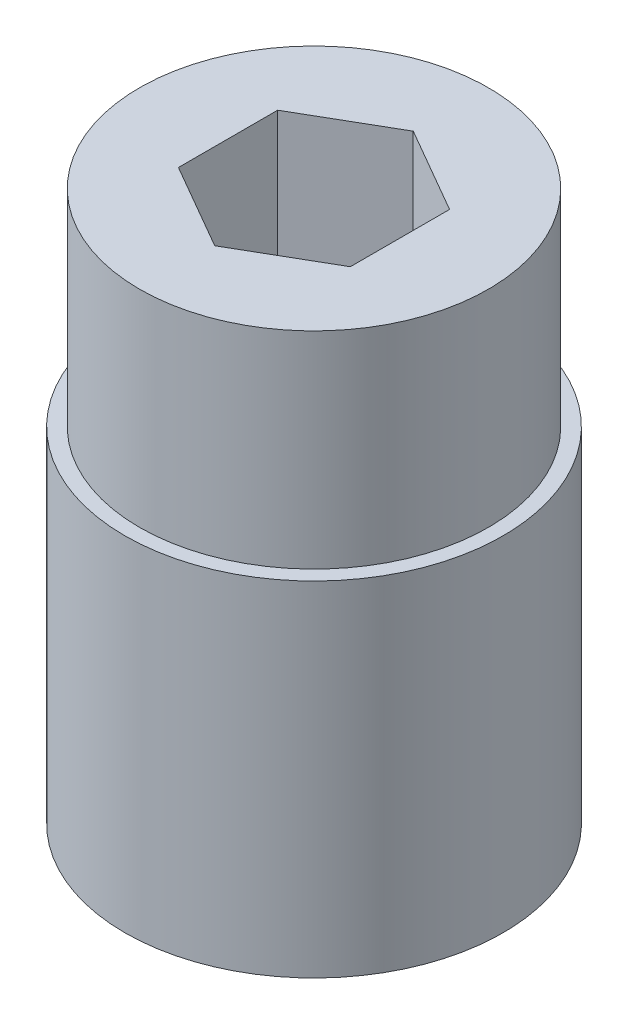
from build123d import *

# Parameters (mm, degrees)
SKETCH1_R           = 7
BOSS_EXTRUDE1_DEPTH = 10
SKETCH2_R           = 5.075
BOSS_EXTRUDE2_DEPTH = 6
CUT_EXTRUDE2_DEPTH  = 19.814887722
SKETCH5_OUTSIDE_W   = 21.092
SKETCH5_OUTSIDE_H   = 21.092
SKETCH5_OUTSIDE_R   = 5.5
CUT_EXTRUDE3_DEPTH  = 15.071247279


with BuildPart() as part:
    # Sketch1 → Boss-Extrude1 (new body)
    with BuildSketch(Plane(origin=(0, 0, 0), x_dir=(1, 0, 0), z_dir=(0, 1, 0))):
        Circle(SKETCH1_R)
    extrude(amount=BOSS_EXTRUDE1_DEPTH)

    # Sketch2 → Boss-Extrude2 (add)
    with BuildSketch(Plane(origin=(0, 10, 0), x_dir=(1, 0, 0), z_dir=(0, 1, 0))):
        Circle(SKETCH2_R)
    extrude(amount=BOSS_EXTRUDE2_DEPTH)

    # Sketch4 → Cut-Extrude2 (cut, through all)
    with BuildSketch(Plane(origin=(0, 16, 0), x_dir=(1, 0, 0), z_dir=(0, 1, 0))):
        Polygon((2.5, 1.443375673), (0, 2.886751346), (-2.5, 1.443375673), (-2.5, -1.443375673), (0, -2.886751346), (2.5, -1.443375673), align=None)
    extrude(amount=-CUT_EXTRUDE2_DEPTH, mode=Mode.SUBTRACT)

    # Sketch5 outside → Cut-Extrude3 (cut, through all)
    with BuildSketch(Plane(origin=(0, 10, 0), x_dir=(1, 0, 0), z_dir=(0, 1, 0))):
        Rectangle(SKETCH5_OUTSIDE_W, SKETCH5_OUTSIDE_H)
        Circle(SKETCH5_OUTSIDE_R, mode=Mode.SUBTRACT)
    extrude(amount=-CUT_EXTRUDE3_DEPTH, mode=Mode.SUBTRACT)


solid = part.part
